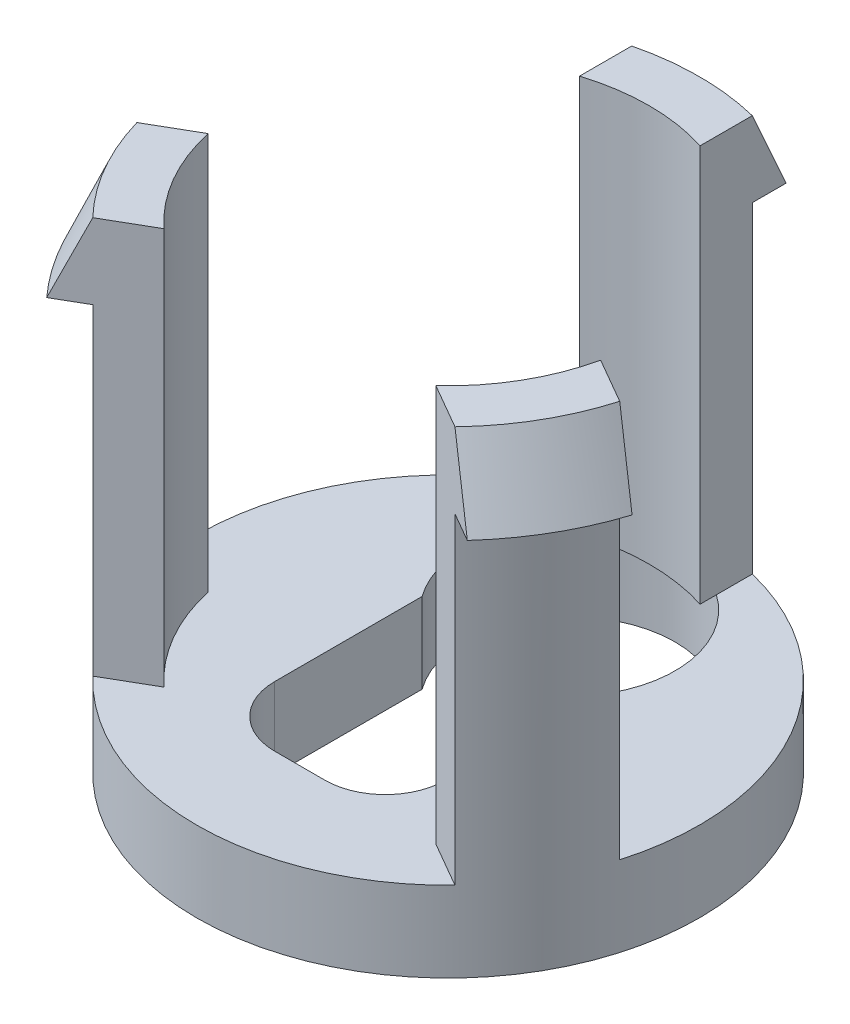
from build123d import *
from build123d.topology import SkipClean

# Parameters (mm, degrees)
SKETCH1_R           = 5
BOSS_EXTRUDE1_DEPTH = 1.6
BOSS_EXTRUDE2_DEPTH = 7.9
CIRPATTERN3_COUNT   = 3
CUT_EXTRUDE2_DEPTH  = 12.240212189
CUT_EXTRUDE3_DEPTH  = 12.310719255
CUT_EXTRUDE4_DEPTH  = 12.10732297


with BuildPart() as part:
    # Sketch1 → Boss-Extrude1 (new body)
    with BuildSketch(Plane(origin=(0, 0, 0), x_dir=(1, 0, 0), z_dir=(0, 1, 0))):
        Circle(SKETCH1_R)
    extrude(amount=BOSS_EXTRUDE1_DEPTH)

    # Sketch2 → Boss-Extrude2 (add)
    with BuildSketch(Plane(origin=(0, 1.6, 0), x_dir=(1, 0, 0), z_dir=(0, 1, 0))):
        with BuildLine():
            Line((-1.2, 4.85386444), (-1.2, 3.815756806))
            ThreePointArc((-1.2, 3.815756806), (0, 4), (1.2, 3.815756806))
            Line((1.2, 3.815756806), (1.2, 4.85386444))
            ThreePointArc((1.2, 4.85386444), (0, 5), (-1.2, 4.85386444))
        make_face()
    boss_extrude2 = extrude(amount=BOSS_EXTRUDE2_DEPTH)

    # CirPattern3: Boss-Extrude2 ×3 about axis
    cirpattern3_axis = Axis((0, 1.6, 0), (0, -1, 0))
    for i in range(1, CIRPATTERN3_COUNT):
        add(boss_extrude2.rotate(cirpattern3_axis, i * 360 / CIRPATTERN3_COUNT))

    # Sweep3: sweep along a path in Sketch6
    with SkipClean():  # the faces are left unmerged after this step: merging them gives an invalid solid
        with BuildLine(Plane(origin=(0, 9.5, 0), x_dir=(1, 0, 0), z_dir=(0, 1, 0))) as sweep3_path:
            CenterArc((0, 0), 5, 0, 360)
        # Sketch3 → Sweep3 (sweep)
        with BuildSketch(Plane(origin=(0, 0, 0), x_dir=(0, 0, -1), z_dir=(1, 0, 0))):
            Polygon((5, 9.5), (5.65386444, 8), (4.85386444, 8), (4.85386444, 9.5), align=None)
        sweep(path=sweep3_path.line)
    add(part.part.scale(1), mode=Mode.REPLACE)  # the faces are merged on a copy

    # Sketch7 → Cut-Extrude2 (cut, through all)
    with BuildSketch(Plane(origin=(0, 1.6, 0), x_dir=(1, 0, 0), z_dir=(0, 1, 0))):
        with BuildLine():
            Line((-3.904542328, -0.868647918), (-4.803569911, -1.387701735))
            ThreePointArc((-4.803569911, -1.387701735), (-4.330127019, 2.5), (-1.2, 4.85386444))
            Line((-1.2, 4.85386444), (-1.2, 3.815756806))
            ThreePointArc((-1.2, 3.815756806), (0, 4), (1.2, 3.815756806))
            Line((1.2, 3.815756806), (1.2, 4.85386444))
            ThreePointArc((1.2, 4.85386444), (4.330127019, 2.5), (4.803569911, -1.387701735))
            Line((4.803569911, -1.387701735), (3.904542328, -0.868647918))
            ThreePointArc((3.904542328, -0.868647918), (3.464101615, -2), (2.704542328, -2.947108887))
            Line((2.704542328, -2.947108887), (3.603569911, -3.466162704))
            ThreePointArc((3.603569911, -3.466162704), (0, -5), (-3.603569911, -3.466162704))
            Line((-3.603569911, -3.466162704), (-2.704542328, -2.947108887))
            ThreePointArc((-2.704542328, -2.947108887), (-3.464101615, -2), (-3.904542328, -0.868647918))
        make_face()
    extrude(amount=CUT_EXTRUDE2_DEPTH, mode=Mode.SUBTRACT)

    # Sketch8 → Cut-Extrude3 (cut, through all)
    with BuildSketch(Plane.XZ.offset(-8)):
        with BuildLine():
            Line((-3.603569911, 3.466162704), (-4.184834096, 3.801755738))
            ThreePointArc((-4.184834096, 3.801755738), (0, 5.65386444), (4.184834096, 3.801755738))
            Line((4.184834096, 3.801755738), (3.603569911, 3.466162704))
            ThreePointArc((3.603569911, 3.466162704), (0, 5), (-3.603569911, 3.466162704))
        make_face()
        with BuildLine():
            Line((-5.384834096, 1.723294769), (-4.803569911, 1.387701735))
            ThreePointArc((-4.803569911, 1.387701735), (-4.330127019, -2.5), (-1.2, -4.85386444))
            Line((-1.2, -4.85386444), (-1.2, -5.525050507))
            ThreePointArc((-1.2, -5.525050507), (-4.896390234, -2.82693222), (-5.384834096, 1.723294769))
        make_face()
        with BuildLine():
            Line((1.2, -5.525050507), (1.2, -4.85386444))
            ThreePointArc((1.2, -4.85386444), (4.330127019, -2.5), (4.803569911, 1.387701735))
            Line((4.803569911, 1.387701735), (5.384834096, 1.723294769))
            ThreePointArc((5.384834096, 1.723294769), (4.896390234, -2.82693222), (1.2, -5.525050507))
        make_face()
    extrude(amount=-CUT_EXTRUDE3_DEPTH, mode=Mode.SUBTRACT)

    # Sketch9 → Cut-Extrude4 (cut, through all)
    with BuildSketch(Plane(origin=(0, 1.6, 0), x_dir=(1, 0, 0), z_dir=(0, 1, 0))):
        with BuildLine():
            Line((-1.7, 1.183307578), (-1.7, -1.75))
            ThreePointArc((-1.7, -1.75), (-1.348528137, -2.598528137), (-0.5, -2.95))
            Line((-0.5, -2.95), (0.5, -2.95))
            ThreePointArc((0.5, -2.95), (1.348528137, -2.598528137), (1.7, -1.75))
            Line((1.7, -1.75), (1.7, 1.183307578))
            ThreePointArc((1.7, 1.183307578), (0, 4.516190379), (-1.7, 1.183307578))
        make_face()
    extrude(amount=-CUT_EXTRUDE4_DEPTH, mode=Mode.SUBTRACT)


solid = part.part
